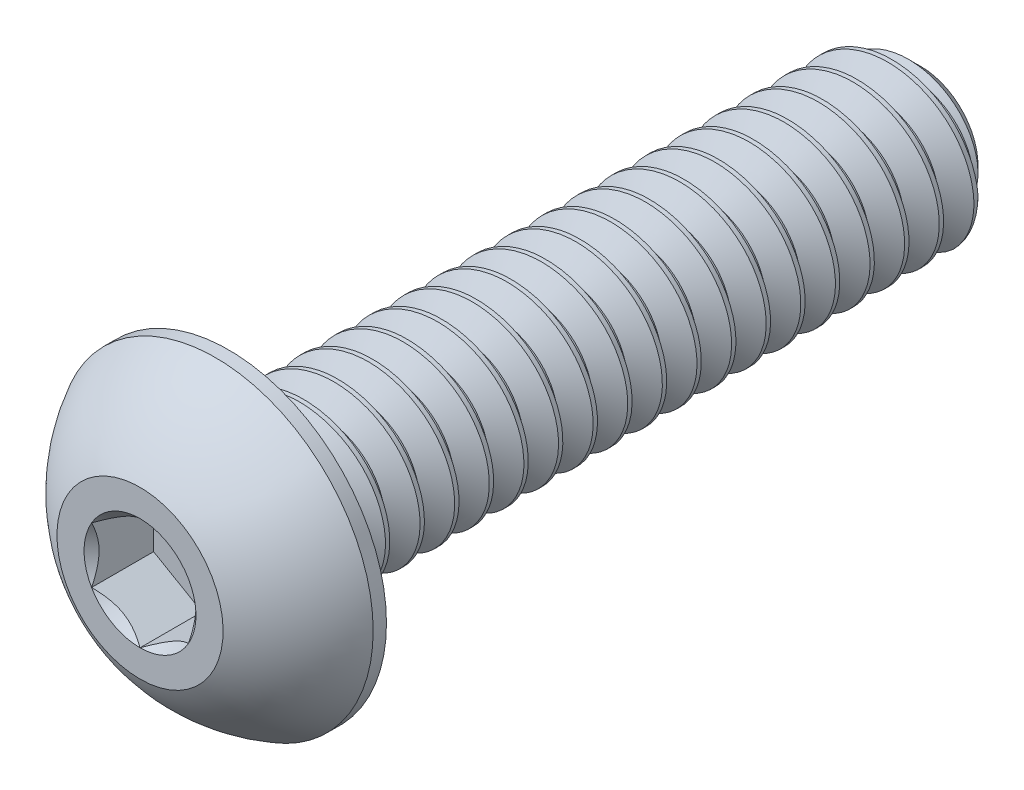
from build123d import *

# Parameters (mm, degrees)
SKETCH1_W          = 6.35
SKETCH1_H          = 0.762
CHAMFER1_SIZE      = 0.238125
CUT_SWEEP1_PITCH   = 0.3175
CUT_EXTRUDE2_DEPTH = 0.56896


with BuildPart() as part:
    # Sketch1 → Revolve1 (revolve)
    with BuildSketch(Plane(origin=(0, 0, 0), x_dir=(0, 0, -1), z_dir=(1, 0, 0))):
        with Locations((3.9878, 0.381)):
            Rectangle(SKETCH1_W, SKETCH1_H)
    revolve(axis=Axis((0, 0, -7.1628), (0, 0, 1)))

    # Chamfer1
    chamfer1_edges = [part.edges().sort_by_distance(p)[0] for p in [
        (0, -0.762, -7.1628),
    ]]
    chamfer(chamfer1_edges, length=CHAMFER1_SIZE)

    # Cut-Sweep1: the profile of Sketch2 profile screwed along a right-hand helix of 24 turns, 6 arcs to a turn; built about Z, then put on its axis
    cut_sweep1_z = Axis((0, 0, 0), (0, 0, 1))
    cut_sweep1_corners = [(0.7623, 0, 0.000173205), (0.7623, 0, -0.277985705), (0.555777701, 0, -0.15875), (0.555777701, 0, -0.1190625)]
    with BuildLine(mode=Mode.PRIVATE) as cut_sweep1_profile:
        Line(cut_sweep1_corners[0], cut_sweep1_corners[1])
        Line(cut_sweep1_corners[1], cut_sweep1_corners[2])
        Line(cut_sweep1_corners[2], cut_sweep1_corners[3])
        Line(cut_sweep1_corners[3], cut_sweep1_corners[0])
    cut_sweep1_cap = Face(cut_sweep1_profile.wire())
    cut_sweep1_turn_angles = [0, 30, 60, 90, 120, 150, 180, 210, 240, 270, 300, 330, 360]
    cut_sweep1_turn_weights = [1, 0.8660254037844387, 1, 0.8660254037844387, 1, 0.8660254037844387, 1, 0.8660254037844387, 1, 0.8660254037844387, 1, 0.8660254037844387, 1]
    cut_sweep1_turn_rails = [Edge.make_bspline([Vector(p[0], p[1], 0).rotate(cut_sweep1_z, cut_sweep1_turn_angles[k]) / cut_sweep1_turn_weights[k] + Vector(0, 0, p[2] + CUT_SWEEP1_PITCH * cut_sweep1_turn_angles[k] / 360) for k in range(13)], [0, 0, 0, 1, 1, 2, 2, 3, 3, 4, 4, 5, 5, 6, 6, 6], 2, cut_sweep1_turn_weights) for p in cut_sweep1_corners]
    cut_sweep1_turn_sides = [Face.make_surface_from_curves(cut_sweep1_turn_rails[p[0]], cut_sweep1_turn_rails[p[1]]) for p in [(0, 1), (1, 2), (2, 3), (3, 0)]]
    cut_sweep1 = Plane(origin=(0, 0, -7.1628), x_dir=(0, 1, 0), z_dir=(0, 0, 1)) * Solid(Shell([*[p.moved(Location((0, 0, CUT_SWEEP1_PITCH * i))) for i in range(24) for p in cut_sweep1_turn_sides], cut_sweep1_cap, cut_sweep1_cap.rotate(cut_sweep1_z, 8640).moved(Location((0, 0, CUT_SWEEP1_PITCH * 8640 / 360)))]))
    add(cut_sweep1, mode=Mode.SUBTRACT)

    # Sketch7 → Revolve2 (revolve)
    with BuildSketch(Plane(origin=(0, 0, 0), x_dir=(0, 0, -1), z_dir=(1, 0, 0)), mode=Mode.PRIVATE) as revolve2_sk:
        with BuildLine():
            Line((0.69088, 1.4478), (0.8128, 1.4478))
            Line((0.8128, 1.4478), (0.8128, 0))
            Line((0.8128, 0), (0, 0))
            Line((0, 0), (0, 0.762))
            ThreePointArc((0, 0.762), (0.293086751, 1.157641051), (0.69088, 1.4478))
        make_face()
    revolve(revolve2_sk.sketch.rotate(Axis((0, 0, 0), (0, 0, -1)), 189.336081704), axis=Axis((0, 0, 0), (0, 0, -1)))

    # Sketch5 → Cut-Extrude2 (cut)
    with BuildSketch(Plane.XY):
        Polygon((0.4445, -0.256632195), (0.4445, 0.256632195), (0, 0.513264389), (-0.4445, 0.256632195), (-0.4445, -0.256632195), (0, -0.513264389), align=None)
    extrude(amount=-CUT_EXTRUDE2_DEPTH, mode=Mode.SUBTRACT)

    # Cut-Extrude3 cone 1 section (through the dimple's axis) → Cut-Extrude3 (revolve, cut)
    with BuildSketch(Plane(origin=(0, 0, 0), x_dir=(0, -1, 0), z_dir=(1, 0, 0))):
        Polygon((0, 0), (0.513264389, 0), (0, 0.513264389), align=None)
    revolve(axis=Axis((0, 0, 0), (0, 0, -1)), mode=Mode.SUBTRACT)


solid = part.part
